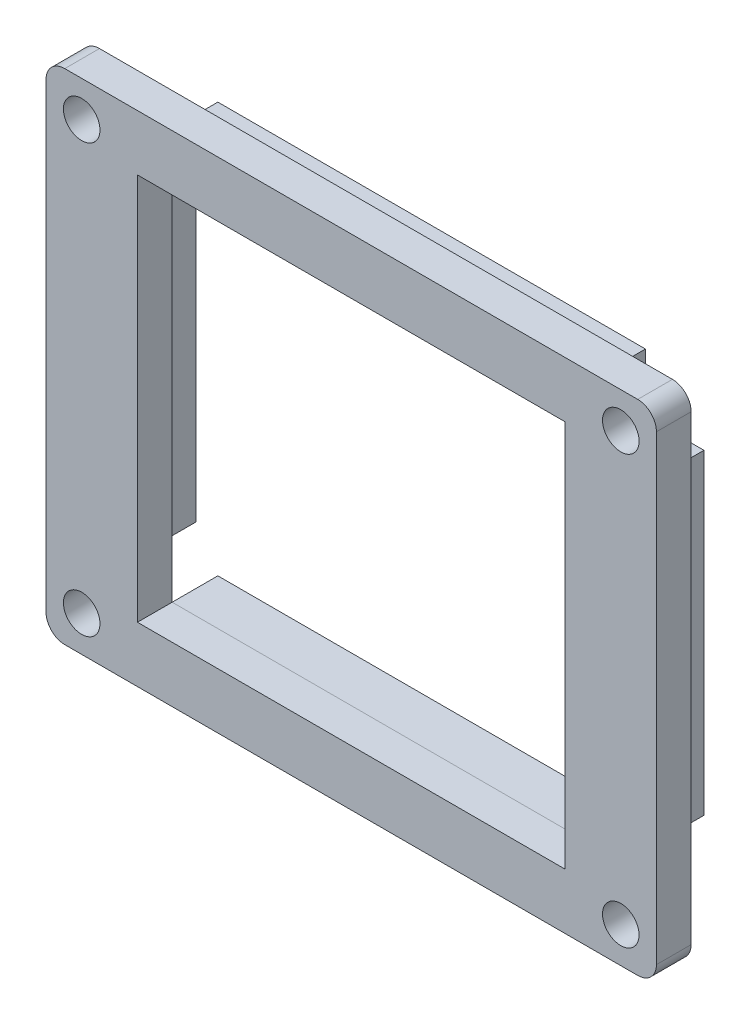
from build123d import *

# Parameters (mm, degrees)
SKETCH1_W           = 84.836
SKETCH1_H           = 69.342
BASE_FLANGE1_DEPTH  = 4.826
SKETCH6_R           = 2.54
CUT_EXTRUDE1_DEPTH  = 10
FILLET1_R           = 2.6
SKETCH11_W          = 59.436
SKETCH11_H          = 3.175
SKETCH11_W_2        = 5.08
SKETCH11_H_2        = 43.942
SKETCH11_W_3        = 2.794
BOSS_EXTRUDE1_DEPTH = 6.35
SKETCH12_W          = 59.436
SKETCH12_H          = 53.848
CUT_EXTRUDE5_DEPTH  = 56.151495583


# Sheet-metal steps are written as plain solids
with BuildPart() as part:
    # Sketch1 → Base-Flange1 (new body)
    with BuildSketch(Plane.XY):
        Rectangle(SKETCH1_W, SKETCH1_H)
    extrude(amount=-BASE_FLANGE1_DEPTH)

    # Sketch6 → Cut-Extrude1 (cut)
    with BuildSketch(Plane.XY):
        with Locations((-37.465, 29.718)):
            Circle(SKETCH6_R)
        with Locations(Location((-37.465, -29.718, 0), (0, 0, 180))):
            Circle(SKETCH6_R)
        with Locations((37.465, -29.718)):
            Circle(SKETCH6_R)
        with Locations(Location((37.465, 29.718, 0), (0, 0, 180))):
            Circle(SKETCH6_R)
    extrude(amount=-CUT_EXTRUDE1_DEPTH, mode=Mode.SUBTRACT)

    # Fillet1
    fillet1_edges = [part.edges().sort_by_distance(p)[0] for p in [
        (-42.418, 34.671, -2.413),
        (42.418, 34.671, -2.413),
        (42.418, -34.671, -2.413),
        (-42.418, -34.671, -2.413),
    ]]
    fillet(fillet1_edges, radius=FILLET1_R)

    # Sketch11 → Boss-Extrude1 (add)
    with BuildSketch(Plane(origin=(0, 0, -4.826), x_dir=(-1, 0, 0), z_dir=(0, 0, -1))):
        with Locations((0, 28.5115)):
            Rectangle(SKETCH11_W, SKETCH11_H)
        with Locations((35.306, 0)):
            Rectangle(SKETCH11_W_2, SKETCH11_H_2)
        with Locations((0, -28.5115)):
            Rectangle(SKETCH11_W, SKETCH11_H)
        with Locations((-36.449, 0)):
            Rectangle(SKETCH11_W_3, SKETCH11_H_2)
    extrude(amount=BOSS_EXTRUDE1_DEPTH)

    # Sketch12 → Cut-Extrude5 (cut, through all)
    with BuildSketch(Plane(origin=(0, 0, -4.826), x_dir=(-1, 0, 0), z_dir=(0, 0, -1))):
        Rectangle(SKETCH12_W, SKETCH12_H)
    extrude(amount=-CUT_EXTRUDE5_DEPTH, mode=Mode.SUBTRACT)


solid = part.part
